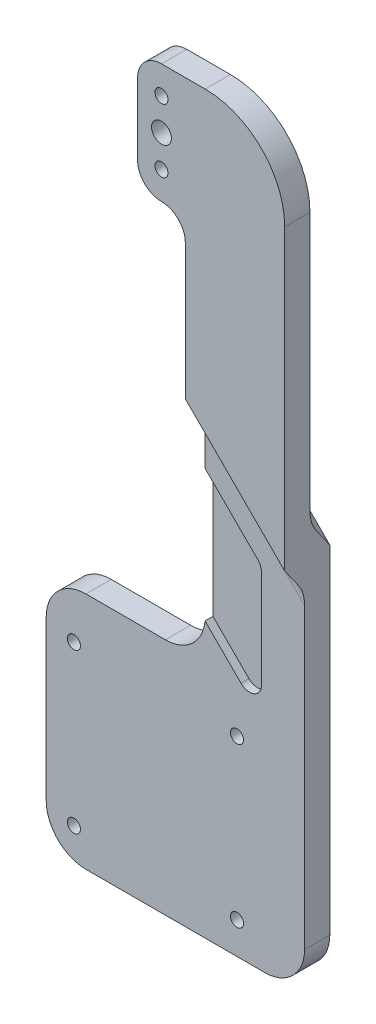
from build123d import *

# Parameters (mm, degrees)
SKETCH1_W               = 12
SKETCH1_H               = 30
SKETCH1_R               = 1.65
SKETCH1_R_2             = 2.5
BOSS_EXTRUDE1_DEPTH     = 6.35
FILLET1_R               = 6
FILLET2_R               = 6
FILLET3_R               = 20
SKETCH2_R               = 1.65
CUT_EXTRUDE1_DEPTH      = 10
CUT_EXTRUDE3_DEPTH      = 5
BOSS_EXTRUDE3_DEPTH     = 5
CHAMFER2_SIZE           = 5
FILLET5_R               = 5
SKETCH6_R               = 1.65
CUT_EXTRUDE4_DEPTH      = 178.83791075
CUT_EXTRUDE5_DEPTH      = 178.83791075
CUT_EXTRUDE5_DEPTH_BACK = 2
FILLET6_R               = 3
SKETCH8_W               = 40
SKETCH8_H               = 60
SKETCH8_R               = 1.65
BOSS_EXTRUDE4_DEPTH     = 6.35
FILLET7_R               = 10


with BuildPart() as part:
    # Sketch1 → Boss-Extrude1 (new body)
    # profile 1 of 2: a face of its own
    with BuildSketch(Plane.XY):
        Polygon((6, 15), (6, -15), (6, -175), (31, -175), (31, 15), align=None)
    # profile 2 of 2: a face of its own
    with BuildSketch(Plane.XY):
        Rectangle(SKETCH1_W, SKETCH1_H)
        with Locations((0, -8)):
            Circle(SKETCH1_R, mode=Mode.SUBTRACT)
        Circle(SKETCH1_R_2, mode=Mode.SUBTRACT)
        with Locations((0, 8)):
            Circle(SKETCH1_R, mode=Mode.SUBTRACT)
    extrude(amount=BOSS_EXTRUDE1_DEPTH)

    # Fillet1
    fillet1_edges = [part.edges().sort_by_distance(p)[0] for p in [
        (6, -15, 3.175),
    ]]
    fillet(fillet1_edges, radius=FILLET1_R)
    fillet1_2_edges = [part.edges().sort_by_distance(p)[0] for p in [
        (-6, -15, 3.175),
    ]]
    fillet(fillet1_2_edges, radius=FILLET1_R - 0.0001)  # a hair under: the kernel refuses the full size

    # Fillet2
    fillet2_edges = [part.edges().sort_by_distance(p)[0] for p in [
        (-6, 15, 3.175),
    ]]
    fillet(fillet2_edges, radius=FILLET2_R)

    # Fillet3
    fillet3_edges = [part.edges().sort_by_distance(p)[0] for p in [
        (31, 15, 3.175),
    ]]
    fillet(fillet3_edges, radius=FILLET3_R)

    # Sketch2 → Cut-Extrude1 (cut)
    with BuildSketch(Plane.XY.offset(6.35)):
        with Locations((14, -167)):
            Circle(SKETCH2_R)
        with Locations((14, -127)):
            Circle(SKETCH2_R)
    extrude(amount=-CUT_EXTRUDE1_DEPTH, mode=Mode.SUBTRACT)

    # Sketch3 → Cut-Extrude3 (cut)
    with BuildSketch(Plane.XY.offset(6.35)):
        Polygon((31, -175), (31, -80), (6, -55), (6, -175), align=None)
    extrude(amount=-CUT_EXTRUDE3_DEPTH, mode=Mode.SUBTRACT)

    # Sketch5 → Boss-Extrude3 (add)
    with BuildSketch(Plane(origin=(0, 0, 0), x_dir=(-1, 0, 0), z_dir=(0, 0, -1))):
        Polygon((-6, -175), (-6, -55), (-31, -80), (-31, -175), align=None)
    extrude(amount=BOSS_EXTRUDE3_DEPTH)

    # Chamfer2
    chamfer2_edges = [part.edges().sort_by_distance(p)[0] for p in [
        (18.5, -67.5, 1.35),
        (18.5, -67.5, 0),
    ]]
    chamfer(chamfer2_edges, length=CHAMFER2_SIZE - 0.0001)  # a hair under: the kernel refuses the full size

    # Fillet5
    fillet5_edges = [part.edges().sort_by_distance(p)[0] for p in [
        (18.5, -74.570926391, 1.35),
        (18.5, -60.429073609, 0),
    ]]
    fillet(fillet5_edges, radius=FILLET5_R)

    # Sketch6 → Cut-Extrude4 (cut, through all)
    with BuildSketch(Plane.XY.offset(1.35)):
        with Locations((14, -127)):
            Circle(SKETCH6_R)
        with Locations((14, -167)):
            Circle(SKETCH6_R)
    extrude(amount=-CUT_EXTRUDE4_DEPTH, mode=Mode.SUBTRACT)

    # Sketch7 → Cut-Extrude5 (cut, two sides: drawn at the far end of the back side and taken through both)
    with BuildSketch(Plane.XY.offset(1.35).offset(-CUT_EXTRUDE5_DEPTH_BACK)):
        Polygon((-175.7227113, 75.782237154), (6, -105.940474145), (20.142135624, -120.082609769), (20.142135624, -86.828079155), (6, -72.685943532), (-175.7227113, 109.036767768), (-689.712157123, 109.036767768), (-689.712157123, 75.782237154), align=None)
    extrude(amount=CUT_EXTRUDE5_DEPTH + CUT_EXTRUDE5_DEPTH_BACK, mode=Mode.SUBTRACT)

    # Fillet6
    fillet6_edges = [part.edges().sort_by_distance(p)[0] for p in [
        (20.142135624, -86.828079155, 0.35),
        (20.142135624, -120.082609769, 0.35),
    ]]
    fillet(fillet6_edges, radius=FILLET6_R)

    # Sketch8 → Boss-Extrude4 (add)
    with BuildSketch(Plane.XY.offset(1.35)):
        with Locations((-14, -145)):
            Rectangle(SKETCH8_W, SKETCH8_H)
        with Locations((-27.03159011, -127)):
            Circle(SKETCH8_R, mode=Mode.SUBTRACT)
        with Locations((-27.03159011, -167)):
            Circle(SKETCH8_R, mode=Mode.SUBTRACT)
    extrude(amount=-BOSS_EXTRUDE4_DEPTH)

    # Fillet7
    fillet7_edges = [part.edges().sort_by_distance(p)[0] for p in [
        (6, -115, -1.825),
        (31, -175, -1.825),
        (-34, -175, -1.825),
        (-34, -115, -1.825),
    ]]
    fillet(fillet7_edges, radius=FILLET7_R)


solid = part.part
